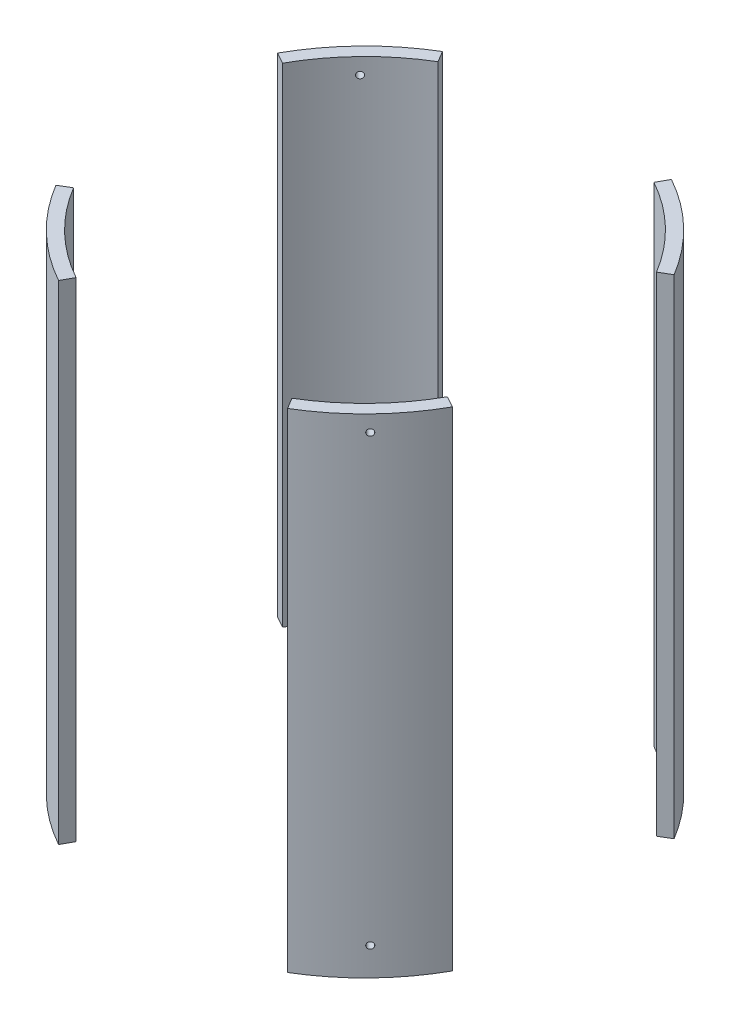
from build123d import *

# Parameters (mm, degrees)
SKETCH2_R               = 88.9
SKETCH2_R_2             = 83.82
BOSS_EXTRUDE1_DEPTH     = 96.36633
CUT_EXTRUDE1_DEPTH      = 159.407353231
CUT_EXTRUDE1_DEPTH_BACK = 159.407353231
SKETCH5_R               = 1.27
BOLT_HOLES_DEPTH        = 214.797490378
BOLT_PATTERN_COUNT      = 4


with BuildPart() as part:
    # Sketch2 → Boss-Extrude1 (new, symmetric)
    with BuildSketch(Plane(origin=(0, 0, 0), x_dir=(1, 0, 0), z_dir=(0, 1, 0))):
        Circle(SKETCH2_R)
        Circle(SKETCH2_R_2, mode=Mode.SUBTRACT)
    extrude(amount=BOSS_EXTRUDE1_DEPTH, both=True)

    # Sketch3 → Cut-Extrude1 (cut, two sides: drawn at the far end of the back side and taken through both)
    with BuildSketch(Plane(origin=(0, 0, 0), x_dir=(1, 0, 0), z_dir=(0, 1, 0)).offset(-CUT_EXTRUDE1_DEPTH_BACK)):
        Polygon((-58.116685864, 96.974944394), (0, 0), (53.900027233, 96.974944394), align=None)
        Polygon((70.991745134, -118.45858783), (0, 0), (-65.840936026, -118.45858783), align=None)
        Polygon((169.661755759, 101.677593364), (0, 0), (169.661755759, -94.300371224), align=None)
        Polygon((-123.741299607, -74.157652604), (0, 0), (-123.741299607, 68.777140945), align=None)
    extrude(amount=CUT_EXTRUDE1_DEPTH + CUT_EXTRUDE1_DEPTH_BACK, mode=Mode.SUBTRACT)


with BuildPart() as cut_extrude1_piece_1:
    # of the separate pieces the step leaves, piece 1, a body of its own (cut_extrude1_pieces)
    add(part.part.solids().sort_by_distance((-45.699187432, -96.36633, -76.254798328))[0])


with BuildPart() as cut_extrude1_piece_2:
    # of the separate pieces the step leaves, piece 2, a body of its own (cut_extrude1_pieces)
    add(part.part.solids().sort_by_distance((45.699187432, -96.36633, 76.254798328))[0])


with BuildPart() as cut_extrude1_piece_3:
    # of the separate pieces the step leaves, piece 3, a body of its own (cut_extrude1_pieces)
    add(part.part.solids().sort_by_distance((76.254798328, -96.36633, -45.699187432))[0])


with BuildPart() as cut_extrude1_piece_4:
    # of the separate pieces the step leaves, piece 4, a body of its own (cut_extrude1_pieces)
    add(part.part.solids().sort_by_distance((-76.254798328, -96.36633, 45.699187432))[0])

    # Sketch5 → Bolt holes (cut, through all)
    with BuildSketch(Plane(origin=(-56.309218645, 0, 58.175814955), x_dir=(-0.7185401515036821, 0, -0.6954854784084752), z_dir=(0.6954854784084752, 0, -0.7185401515036821))):
        with Locations((-0.02278764, 90.01633)):
            Circle(SKETCH5_R)
        with Locations((-0.02278764, -85.25383)):
            Circle(SKETCH5_R)
    bolt_holes = extrude(amount=-BOLT_HOLES_DEPTH, mode=Mode.SUBTRACT)


with BuildPart() as bolt_pattern_tool:
    # Bolt pattern: Bolt holes ×4 about axis
    bolt_pattern_axis = Axis((0, 96.36633, 0), (0, 1, 0))
    for i in range(1, BOLT_PATTERN_COUNT):
        add(bolt_holes.rotate(bolt_pattern_axis, i * 360 / BOLT_PATTERN_COUNT))


with BuildPart() as cut_extrude1_piece_1_1:
    add(cut_extrude1_piece_1.part)

    # Bolt pattern: cut by bolt_pattern_tool
    add(bolt_pattern_tool.part, mode=Mode.SUBTRACT)


with BuildPart() as cut_extrude1_piece_2_1:
    add(cut_extrude1_piece_2.part)

    # Bolt pattern: cut by bolt_pattern_tool
    add(bolt_pattern_tool.part, mode=Mode.SUBTRACT)


with BuildPart() as cut_extrude1_piece_3_1:
    add(cut_extrude1_piece_3.part)

    # Bolt pattern: cut by bolt_pattern_tool
    add(bolt_pattern_tool.part, mode=Mode.SUBTRACT)


solid = Compound([cut_extrude1_piece_4.part, cut_extrude1_piece_1_1.part, cut_extrude1_piece_2_1.part, cut_extrude1_piece_3_1.part])
